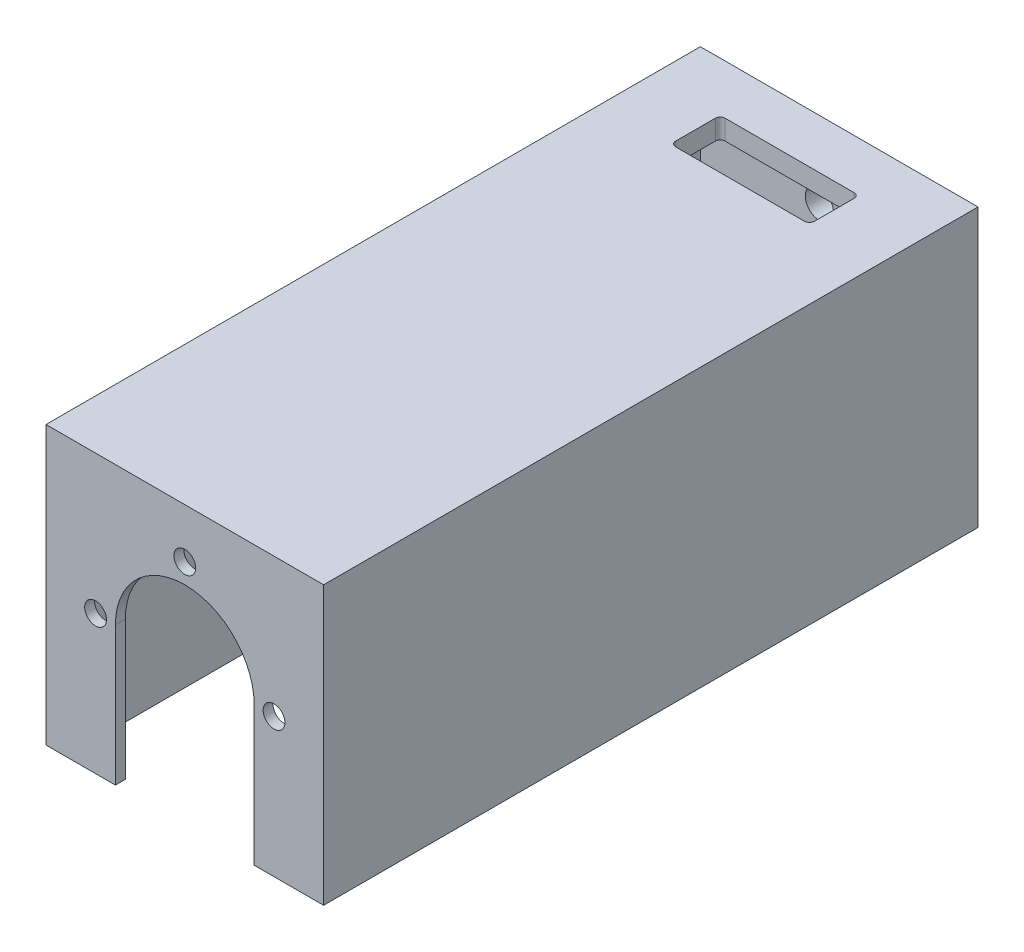
from build123d import *
from OCP.BRepFilletAPI import BRepFilletAPI_MakeFillet

# Parameters (mm, degrees)
SKETCH1_W                 = 28
SKETCH1_H                 = 28
BOSS_EXTRUDE1_DEPTH       = 66
SHELL1_T                  = -2
SHELL1_THICKNESS_2_FACE_W = 24
SHELL1_THICKNESS_2_FACE_H = 26
SHELL1_THICKNESS_2_DEPTH  = 1
SKETCH2_R                 = 2.5
SKETCH2_R_2               = 1.425
CUT_EXTRUDE4_DEPTH        = 2
SKETCH5_W                 = 14
SKETCH5_H                 = 5
CUT_EXTRUDE6_DEPTH        = 10
SKETCH6_R                 = 7
SKETCH6_R_2               = 1.1
CUT_EXTRUDE8_DEPTH        = 10
FILLET1_R                 = 0.5
BOSS_EXTRUDE2_START       = 8
BOSS_EXTRUDE2_DEPTH       = 32
SKETCH16_W                = 4
SKETCH16_H                = 2
BOSS_EXTRUDE9_DEPTH       = 1.5
SKETCH17_W                = 2.65
SKETCH17_H                = 2.3
CUT_EXTRUDE9_DEPTH        = 3
FILLET3_R                 = 1
FILLET3_R_2               = 0.5
CUT_EXTRUDE10_REACH       = 71.226
SKETCH18_W                = 14
SKETCH18_H                = 14


with BuildPart() as part:
    # Sketch1 → Boss-Extrude1 (new body)
    with BuildSketch(Plane.XY):
        Rectangle(SKETCH1_W, SKETCH1_H)
    extrude(amount=BOSS_EXTRUDE1_DEPTH)

    # Shell1
    shell1_openings = [part.faces().sort_by_distance(p)[0] for p in [
        (0, -14, 33),
    ]]
    offset(amount=SHELL1_T, openings=shell1_openings, kind=Kind.INTERSECTION)

    # Shell1 thickness 2 face (on inner face of the shell) → Shell1 thickness 2 (cut)
    with BuildSketch(Plane(origin=(0, -1, 64), x_dir=(1, 0, 0), z_dir=(0, 0, 1))):
        Rectangle(SHELL1_THICKNESS_2_FACE_W, SHELL1_THICKNESS_2_FACE_H)
    extrude(amount=SHELL1_THICKNESS_2_DEPTH, mode=Mode.SUBTRACT)

    # Sketch2 → Cut-Extrude4 (cut)
    with BuildSketch(Plane.XY):
        Circle(SKETCH2_R)
        with Locations((8.25, 0)):
            Circle(SKETCH2_R_2)
        with Locations((0, -8.25)):
            Circle(SKETCH2_R_2)
        with Locations((-8.25, 0)):
            Circle(SKETCH2_R_2)
        with Locations((0, 8.25)):
            Circle(SKETCH2_R_2)
    extrude(amount=CUT_EXTRUDE4_DEPTH, mode=Mode.SUBTRACT)

    # Sketch5 → Cut-Extrude6 (cut)
    with BuildSketch(Plane(origin=(0, 14, 0), x_dir=(1, 0, 0), z_dir=(0, 1, 0))):
        with Locations((0, -7.5)):
            Rectangle(SKETCH5_W, SKETCH5_H)
    extrude(amount=-CUT_EXTRUDE6_DEPTH, mode=Mode.SUBTRACT)

    # Sketch6 → Cut-Extrude8 (cut)
    with BuildSketch(Plane.XY.offset(66)):
        Circle(SKETCH6_R)
        with Locations((0, 9)):
            Circle(SKETCH6_R_2)
        with Locations((9, 0)):
            Circle(SKETCH6_R_2)
        with Locations((0, -9)):
            Circle(SKETCH6_R_2)
        with Locations((-9, 0)):
            Circle(SKETCH6_R_2)
    extrude(amount=-CUT_EXTRUDE8_DEPTH, mode=Mode.SUBTRACT)

    # Fillet1
    fillet1_edges = [part.edges().sort_by_distance(p)[0] for p in [
        (-7, 13, 5),
        (7, 13, 5),
        (7, 13, 10),
        (-7, 13, 10),
    ]]
    fillet(fillet1_edges, radius=FILLET1_R)

    # Sketch9 → Boss-Extrude2 (add)
    with BuildSketch(Plane.XY.offset(2).offset(BOSS_EXTRUDE2_START)):
        with BuildLine():
            ThreePointArc((6.82202316, 7.65), (9.353829093, 4.191465293), (10.25, 0))
            Line((10.25, 0), (12, 0))
            Line((12, 0), (12, 12))
            Line((12, 12), (-12, 12))
            Line((-12, 12), (-12, 0))
            Line((-12, 0), (-10.25, 0))
            ThreePointArc((-10.25, 0), (-9.353829093, 4.191465293), (-6.82202316, 7.65))
            ThreePointArc((-6.82202316, 7.65), (0, 10.25), (6.82202316, 7.65))
        make_face()
        with BuildLine():
            Line((-6.82202316, 7.65), (-1.292526595, 7.65))
            ThreePointArc((-1.292526595, 7.65), (-0.307225163, 9.641487585), (1.425, 8.25))
            ThreePointArc((1.425, 8.25), (1.391487585, 7.942774837), (1.292526595, 7.65))
            Line((1.292526595, 7.65), (6.82202316, 7.65))
            ThreePointArc((6.82202316, 7.65), (0, 10.25), (-6.82202316, 7.65))
        make_face()
        with BuildLine():
            Line((-1.292526595, 7.65), (0, 7.65))
            Line((0, 7.65), (1.292526595, 7.65))
            ThreePointArc((1.292526595, 7.65), (1.391487585, 7.942774837), (1.425, 8.25))
            ThreePointArc((1.425, 8.25), (-0.307225163, 9.641487585), (-1.292526595, 7.65))
        make_face()
    extrude(amount=BOSS_EXTRUDE2_DEPTH)

    # Sketch16 → Boss-Extrude9 (add)
    with BuildSketch(Plane.XZ.offset(14)):
        with Locations((-2, 1)):
            Rectangle(SKETCH16_W, SKETCH16_H)
        with Locations((2, 1)):
            Rectangle(SKETCH16_W, SKETCH16_H)
    extrude(amount=BOSS_EXTRUDE9_DEPTH)

    # Sketch17 → Cut-Extrude9 (cut)
    with BuildSketch(Plane.XY.offset(2)):
        with Locations((1.325, -12.85)):
            Rectangle(SKETCH17_W, SKETCH17_H)
        with Locations((-1.325, -12.85)):
            Rectangle(SKETCH17_W, SKETCH17_H)
    extrude(amount=-CUT_EXTRUDE9_DEPTH, mode=Mode.SUBTRACT)

    # Fillet3
    fillet3_edges_1 = [part.edges().sort_by_distance(p)[0] for p in [
        (-4, -15.5, 1),
        (4, -15.5, 1),
    ]]
    fillet3_edges_2 = [part.edges().sort_by_distance(p)[0] for p in [
        (4, -14, 1),
        (-4, -14, 1),
    ]]
    fillet3 = BRepFilletAPI_MakeFillet(part.part.solid().wrapped)
    for e in fillet3_edges_1:
        fillet3.Add(FILLET3_R - 0.0001, e.wrapped)
    for e in fillet3_edges_2:
        fillet3.Add(FILLET3_R_2 - 0.0001, e.wrapped)
    add(Compound.cast(fillet3.Shape()), mode=Mode.REPLACE)  # a hair under: the kernel refuses the full size

    # Sketch18 → Cut-Extrude10 (cut, up to next)
    with BuildSketch(Plane.XY.offset(66), mode=Mode.PRIVATE) as cut_extrude10_sk1:
        with Locations((0, -7)):
            Rectangle(SKETCH18_W, SKETCH18_H)
    cut_extrude10_tool1 = extrude(cut_extrude10_sk1.sketch, amount=-CUT_EXTRUDE10_REACH, mode=Mode.PRIVATE) & part.part
    add(cut_extrude10_tool1.solids().sort_by_distance((0, -7, 66))[0], mode=Mode.SUBTRACT)


solid = part.part
